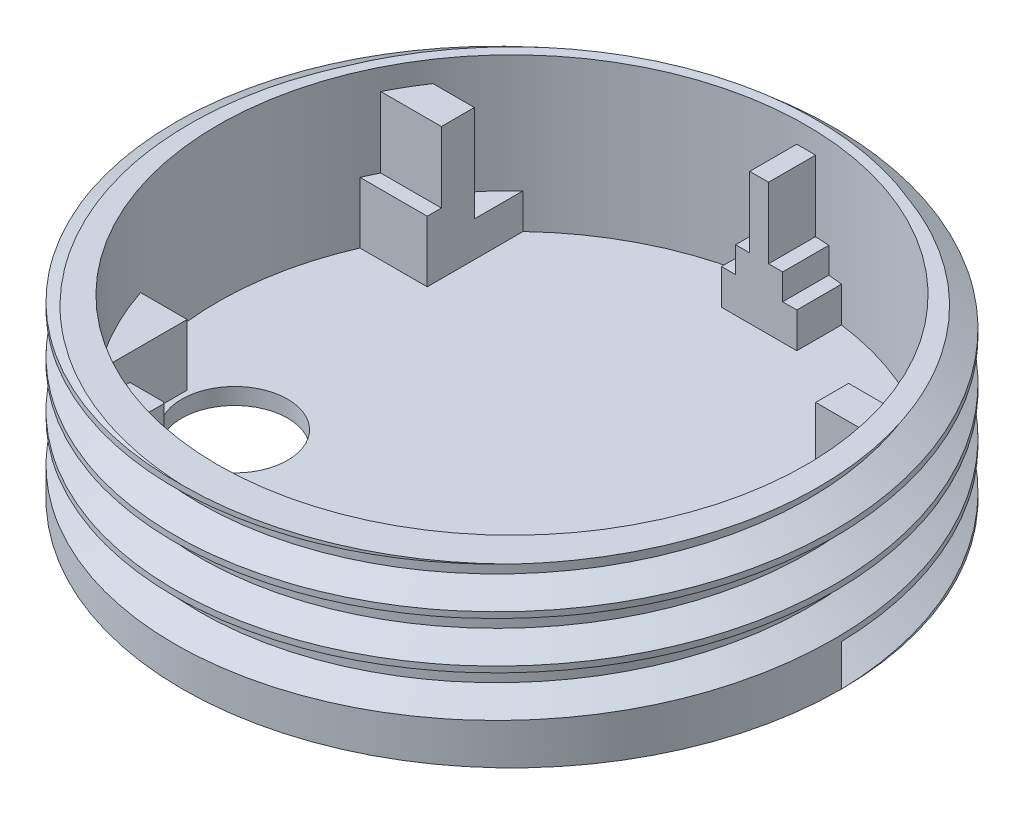
from build123d import *
from build123d.topology import SkipClean

# Parameters (mm, degrees)
SKETCH1_R           = 14
BOSS_EXTRUDE1_DEPTH = 7.5
CUT_EXTRUDE1_START  = 1
SKETCH2_R           = 12.5
CUT_EXTRUDE1_DEPTH  = 21.17191536
BOSS_EXTRUDE3_DEPTH = 1.5
BOSS_EXTRUDE2_DEPTH = 2.6
SKETCH4_R           = 1.7
SKETCH4_R_2         = 0.6
BOSS_EXTRUDE4_DEPTH = 1.5
BOSS_EXTRUDE5_DEPTH = 3
CUT_EXTRUDE2_REACH  = 23.172
SKETCH7_R           = 2.25
SKETCH8_R           = 12
CUT_EXTRUDE3_DEPTH  = 0.3
THREAD1_PITCH       = 2


with BuildPart() as part:
    # Sketch1 → Boss-Extrude1 (new body)
    with BuildSketch(Plane(origin=(0, 0, 0), x_dir=(1, 0, 0), z_dir=(0, 1, 0))):
        with Locations(Location((0, 0, 0), (0, 0, 270))):
            Circle(SKETCH1_R)
    extrude(amount=BOSS_EXTRUDE1_DEPTH)

    # Sketch2 → Cut-Extrude1 (cut, through all)
    with BuildSketch(Plane(origin=(0, 0, 0), x_dir=(1, 0, 0), z_dir=(0, 1, 0)).offset(CUT_EXTRUDE1_START)):
        with Locations(Location((0, 0, 0), (0, 0, 90))):
            Circle(SKETCH2_R)
    extrude(amount=CUT_EXTRUDE1_DEPTH, mode=Mode.SUBTRACT)

    # Sketch3<3> → Boss-Extrude3 (add)
    with BuildSketch(Plane(origin=(0, 1, 0), x_dir=(1, 0, 0), z_dir=(0, 1, 0))):
        with BuildLine():
            Line((-8.6, 7), (-8.6, 9.071383577))
            ThreePointArc((-8.6, 9.071383577), (-9.534497108, 8.083524286), (-10.356157589, 7))
            Line((-10.356157589, 7), (-8.6, 7))
        make_face()
        with BuildLine():
            Line((-1.6, 10.5), (-1, 10.5))
            Line((-1, 10.5), (-1, 12.459935794))
            ThreePointArc((-1, 12.459935794), (-1.300378662, 12.432176613), (-1.6, 12.397177098))
            Line((-1.6, 12.397177098), (-1.6, 10.5))
        make_face()
        with BuildLine():
            Line((1, 12.459935794), (1, 10.5))
            Line((1, 10.5), (1.6, 10.5))
            Line((1.6, 10.5), (1.6, 12.397177098))
            ThreePointArc((1.6, 12.397177098), (1.300378662, 12.432176613), (1, 12.459935794))
        make_face()
        with BuildLine():
            ThreePointArc((11.273420067, 5.4), (10.475630846, 6.819908971), (9.5, 8.124038405))
            Line((9.5, 8.124038405), (9.5, 5.4))
            Line((9.5, 5.4), (11.273420067, 5.4))
        make_face()
        with BuildLine():
            ThreePointArc((-9.9, -7.631513611), (-9.186019897, -8.477442919), (-8.4, -9.256889326))
            Line((-8.4, -9.256889326), (-8.4, -6.331513611))
            Line((-8.4, -6.331513611), (-9.9, -6.331513611))
            Line((-9.9, -6.331513611), (-9.9, -6.902642311))
            Line((-9.9, -6.902642311), (-9.9, -7.631513611))
        make_face()
    extrude(amount=BOSS_EXTRUDE3_DEPTH)

    # Sketch3 → Boss-Extrude2 (add)
    with BuildSketch(Plane(origin=(0, 1, 0), x_dir=(1, 0, 0), z_dir=(0, 1, 0))):
        with BuildLine():
            Line((-9.9, -3.9), (-11.876026271, -3.9))
            ThreePointArc((-11.876026271, -3.9), (-11.249296595, -5.45007579), (-10.4213017, -6.902642311))
            Line((-10.4213017, -6.902642311), (-9.9, -6.902642311))
            Line((-9.9, -6.902642311), (-9.9, -6.331513611))
            Line((-9.9, -6.331513611), (-9.9, -3.9))
        make_face()
        with BuildLine():
            Line((-8.6, 5), (-8.6, 7))
            Line((-8.6, 7), (-10.356157589, 7))
            ThreePointArc((-10.356157589, 7), (-10.952047529, 6.025168456), (-11.456439237, 5))
            Line((-11.456439237, 5), (-8.6, 5))
        make_face()
        with BuildLine():
            Line((-1, 12.459935794), (-1, 10.5))
            Line((-1, 10.5), (1, 10.5))
            Line((1, 10.5), (1, 12.459935794))
            ThreePointArc((1, 12.459935794), (0, 12.5), (-1, 12.459935794))
        make_face()
        with BuildLine():
            Line((11.273420067, 5.4), (9.5, 5.4))
            Line((9.5, 5.4), (9.5, 3.4))
            Line((9.5, 3.4), (12.028715642, 3.4))
            ThreePointArc((12.028715642, 3.4), (11.693903632, 4.416176837), (11.273420067, 5.4))
        make_face()
        with BuildLine():
            Line((-9.9, -6.902642311), (-10.4213017, -6.902642311))
            ThreePointArc((-10.4213017, -6.902642311), (-10.16718442, -7.271750887), (-9.9, -7.631513611))
            Line((-9.9, -7.631513611), (-9.9, -6.902642311))
        make_face()
    extrude(amount=BOSS_EXTRUDE2_DEPTH)

    # Sketch4 → Boss-Extrude4 (add)
    # profile 1 of 2: a face of its own
    with BuildSketch(Plane(origin=(0, 1, 0), x_dir=(1, 0, 0), z_dir=(0, 1, 0))):
        with BuildLine():
            Line((12.268629189, -2.393895952), (9.505920047, -2.393895952))
            ThreePointArc((9.505920047, -2.393895952), (10.708001575, -2.891814424), (11.205920047, -4.093895952))
            ThreePointArc((11.205920047, -4.093895952), (9.505920047, -5.793895952), (7.805920047, -4.093895952))
            Line((7.805920047, -4.093895952), (7.805920047, -9.763073913))
            ThreePointArc((7.805920047, -9.763073913), (10.692197048, -6.475100176), (12.268629189, -2.393895952))
        make_face()
    # profile 2 of 2: a face of its own
    with BuildSketch(Plane(origin=(0, 1, 0), x_dir=(1, 0, 0), z_dir=(0, 1, 0))):
        with Locations((9.505920047, -4.093895952)):
            Circle(SKETCH4_R)
        with Locations(Location((9.505920047, -4.093895952, 0), (0, 0, 270))):
            Circle(SKETCH4_R_2, mode=Mode.SUBTRACT)
    extrude(amount=BOSS_EXTRUDE4_DEPTH)

    # Sketch6 → Boss-Extrude5 (add)
    with BuildSketch(Plane(origin=(0, 3.6, 0), x_dir=(1, 0, 0), z_dir=(0, 1, 0))):
        Polygon((-11.175419455, 7), (-10.356157589, 7), (-8.6, 7), (-8.6, 5.6), (-11.175419455, 5.6), align=None)
        with BuildLine():
            Line((-0.4, 12.493598361), (-0.4, 10.5))
            Line((-0.4, 10.5), (0.4, 10.5))
            Line((0.4, 10.5), (0.4, 12.493598361))
            ThreePointArc((0.4, 12.493598361), (0, 12.5), (-0.4, 12.493598361))
        make_face()
        Polygon((12.028715642, 3.4), (12.028715642, 4.8), (11.541663658, 4.8), (9.5, 4.8), (9.5, 3.4), align=None)
    extrude(amount=BOSS_EXTRUDE5_DEPTH)

    # Sketch7 → Cut-Extrude2 (cut, up to next)
    with BuildSketch(Plane(origin=(0, 0, 0), x_dir=(-1, 0, 0), z_dir=(0, -1, 0)), mode=Mode.PRIVATE) as cut_extrude2_sk1:
        with Locations(Location((7.435, -4.345, 0), (0, 0, 90))):
            Circle(SKETCH7_R)
    cut_extrude2_tool1 = extrude(cut_extrude2_sk1.sketch, amount=-CUT_EXTRUDE2_REACH, mode=Mode.PRIVATE) & part.part
    add(cut_extrude2_tool1.solids().sort_by_distance((-7.435, 0, 4.345))[0], mode=Mode.SUBTRACT)

    # Sketch8 → Cut-Extrude3 (cut)
    with BuildSketch(Plane(origin=(0, 0, 0), x_dir=(-1, 0, 0), z_dir=(0, -1, 0))):
        with Locations(Location((0, 0, 0), (0, 0, 90))):
            Circle(SKETCH8_R)
    extrude(amount=-CUT_EXTRUDE3_DEPTH, mode=Mode.SUBTRACT)

    # Thread1: the profile of Thread Profile1 profile screwed along a right-hand helix of 3.75 turns, 10 arcs to a turn; built about Z, then put on its axis
    with SkipClean():  # the faces are left unmerged after this step: merging them gives an invalid solid
        thread1_z = Axis((0, 0, 0), (0, 0, 1))
        thread1_corners = [(14.0003, 0, -0.000173205), (14.0003, 0, 1.7501732), (12.91746825, 0, 1.124999997), (12.91746825, 0, 0.624999997)]
        with BuildLine(mode=Mode.PRIVATE) as thread1_profile:
            Line(thread1_corners[0], thread1_corners[1])
            Line(thread1_corners[1], thread1_corners[2])
            Line(thread1_corners[2], thread1_corners[3])
            Line(thread1_corners[3], thread1_corners[0])
        thread1_cap = Face(thread1_profile.wire())
        thread1_turn_angles = [0, 18, 36, 54, 72, 90, 108, 126, 144, 162, 180, 198, 216, 234, 252, 270, 288, 306, 324, 342, 360]
        thread1_turn_weights = [1, 0.9510565162951535, 1, 0.9510565162951535, 1, 0.9510565162951535, 1, 0.9510565162951535, 1, 0.9510565162951535, 1, 0.9510565162951535, 1, 0.9510565162951535, 1, 0.9510565162951535, 1, 0.9510565162951535, 1, 0.9510565162951535, 1]
        thread1_turn_rails = [Edge.make_bspline([Vector(p[0], p[1], 0).rotate(thread1_z, thread1_turn_angles[k]) / thread1_turn_weights[k] + Vector(0, 0, p[2] + THREAD1_PITCH * thread1_turn_angles[k] / 360) for k in range(21)], [0, 0, 0, 1, 1, 2, 2, 3, 3, 4, 4, 5, 5, 6, 6, 7, 7, 8, 8, 9, 9, 10, 10, 10], 2, thread1_turn_weights) for p in thread1_corners]
        thread1_turn_sides = [Face.make_surface_from_curves(thread1_turn_rails[p[0]], thread1_turn_rails[p[1]]) for p in [(0, 1), (1, 2), (2, 3), (3, 0)]]
        thread1_last_angles = [1080, 1098, 1116, 1134, 1152, 1170, 1188, 1206, 1224, 1242, 1260, 1278, 1296, 1314, 1332, 1341, 1350]
        thread1_last_weights = [1, 0.9510565162951535, 1, 0.9510565162951535, 1, 0.9510565162951535, 1, 0.9510565162951535, 1, 0.9510565162951535, 1, 0.9510565162951535, 1, 0.9510565162951535, 1, 0.9876883405951378, 1]
        thread1_last_rails = [Edge.make_bspline([Vector(p[0], p[1], 0).rotate(thread1_z, thread1_last_angles[k]) / thread1_last_weights[k] + Vector(0, 0, p[2] + THREAD1_PITCH * thread1_last_angles[k] / 360) for k in range(17)], [0, 0, 0, 1, 1, 2, 2, 3, 3, 4, 4, 5, 5, 6, 6, 7, 7, 8, 8, 8], 2, thread1_last_weights) for p in thread1_corners]
        thread1_last_sides = [Face.make_surface_from_curves(thread1_last_rails[p[0]], thread1_last_rails[p[1]]) for p in [(0, 1), (1, 2), (2, 3), (3, 0)]]
        thread1 = Plane(origin=(0, 0, 0), x_dir=(1, 0, 0), z_dir=(0, 1, 0)) * Solid(Shell([*[p.moved(Location((0, 0, THREAD1_PITCH * i))) for i in range(3) for p in thread1_turn_sides], *thread1_last_sides, thread1_cap, thread1_cap.rotate(thread1_z, 1350).moved(Location((0, 0, THREAD1_PITCH * 1350 / 360)))]))
        add(thread1, mode=Mode.SUBTRACT)


solid = part.part
